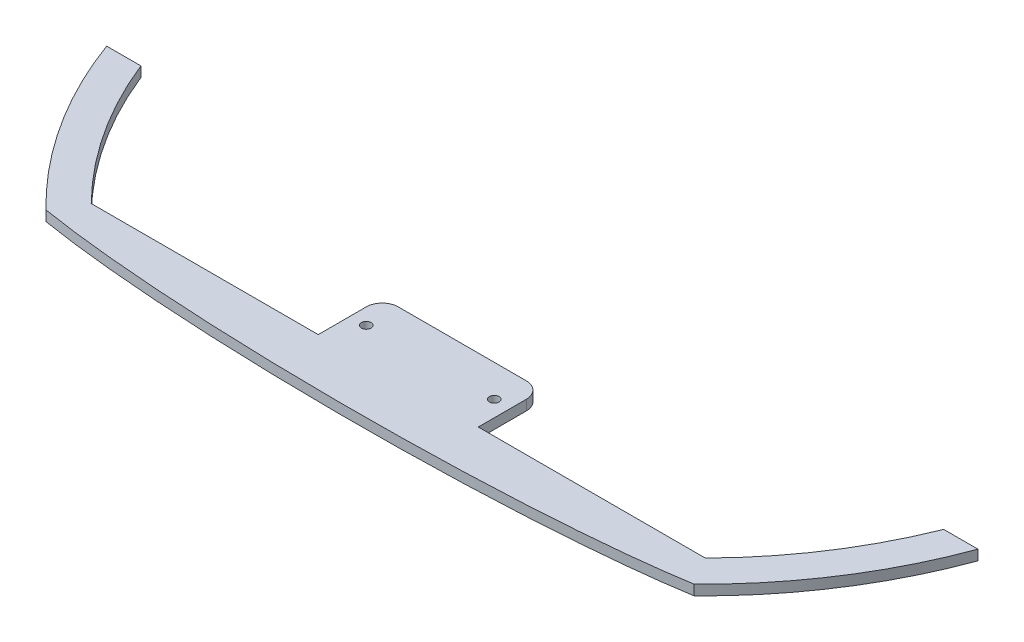
from build123d import *

# Parameters (mm, degrees)
SKETCH_1_R      = 1.5
EXTRUDE_1_DEPTH = 3.175


with BuildPart() as part:
    # 草图1 → 凸台-拉伸1 (new body)
    with BuildSketch(Plane(origin=(0, 0, 0), x_dir=(1, 0, 0), z_dir=(0, 1, 0))):
        with BuildLine():
            Line((-25, -10), (-95.916630466, -10))
            ThreePointArc((-95.916630466, -10), (-112.922283606, 11.016502751), (-125.39936204, 35))
            Line((-125.39936204, 35), (-136.106575888, 35))
            ThreePointArc((-136.106575888, 35), (-121.687593109, 6.15122269), (-101.248422592, -18.796709594))
            add(Edge.make_bspline(
                [(-101.248422592, -18.796709594), (0, -35.577745587), (101.248422592, -18.796709594)],
                knots=[0.62666573, 0.62666573, 0.62666573, 2.514926923, 2.514926923, 2.514926923], degree=2, weights=[1, 0.586447306, 1]))
            ThreePointArc((101.248422592, -18.796709594), (121.687593109, 6.15122269), (136.106575888, 35))
            Line((136.106575888, 35), (125.39936204, 35))
            ThreePointArc((125.39936204, 35), (112.922283606, 11.016502751), (95.916630466, -10))
            Line((95.916630466, -10), (25, -10))
            Line((25, -10), (25, 5))
            ThreePointArc((25, 5), (23.535533906, 8.535533906), (20, 10))
            Line((20, 10), (-20, 10))
            ThreePointArc((-20, 10), (-23.535533906, 8.535533906), (-25, 5))
            Line((-25, 5), (-25, -10))
        make_face()
        with Locations((-20, 0)):
            Circle(SKETCH_1_R, mode=Mode.SUBTRACT)
        with Locations((20, 0)):
            Circle(SKETCH_1_R, mode=Mode.SUBTRACT)
    extrude(amount=EXTRUDE_1_DEPTH)


solid = part.part
